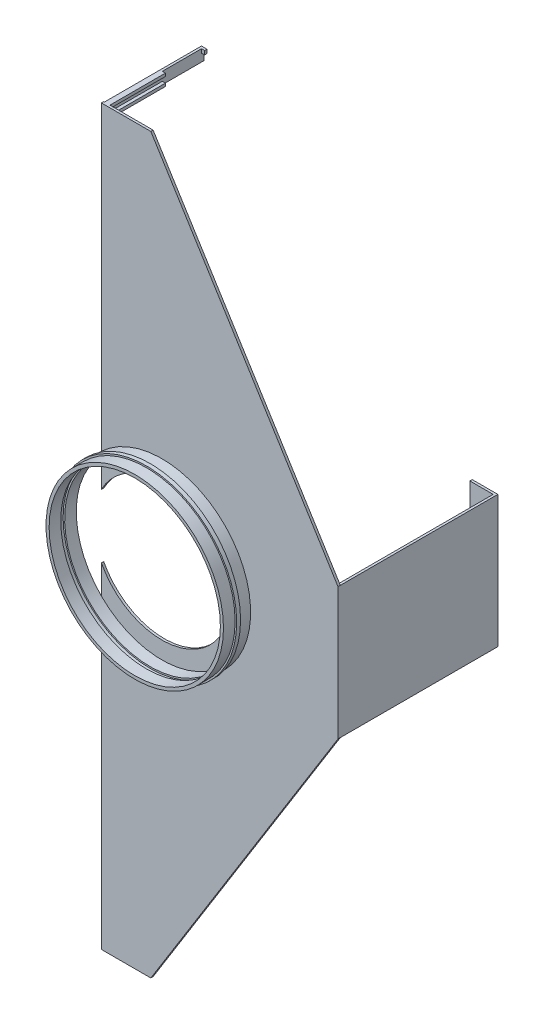
from build123d import *

# Parameters (mm, degrees)
SKETCH1_W       = 305
SKETCH1_H       = 945
EXTRUDE1_DEPTH  = 3
SKETCH2_R       = 114.37
SKETCH2_R_2     = 110.37
EXTRUDE2_DEPTH  = 15
SKETCH3_W       = 3
SKETCH3_H       = 15
EXTRUDE3_DEPTH  = 125
SKETCH4_W       = 3
SKETCH4_H       = 5
SKETCH4_H_2     = 6
SKETCH4_W_2     = 74.4375
SKETCH4_H_3     = 3.826546867
SKETCH4_H_4     = 3.798552334
SKETCH4_W_3     = 55.3875
SKETCH4_H_5     = 4.7625
SKETCH4_H_6     = 3.8875
EXTRUDE4_DEPTH  = 4
SKETCH5_W       = 3
SKETCH5_H       = 170
EXTRUDE5_DEPTH  = 203
SKETCH6_W       = 3
SKETCH6_H       = 170
EXTRUDE6_DEPTH  = 30
EXTRUDE7_DEPTH  = 1014.537863131
SKETCH13_R      = 88.098729295
EXTRUDE10_DEPTH = 1015.142987946
SKETCH22_R      = 116.4
SKETCH22_R_2    = 112.37
EXTRUDE17_DEPTH = 5
SKETCH23_R      = 114.37
SKETCH23_R_2    = 110.37
EXTRUDE18_DEPTH = 15


with BuildPart() as part:
    # Sketch1 → Extrude1 (new body)
    with BuildSketch(Plane.XY):
        with Locations((152.5, 472.5)):
            Rectangle(SKETCH1_W, SKETCH1_H)
    extrude(amount=EXTRUDE1_DEPTH)

    # Sketch2 → Extrude2 (add)
    with BuildSketch(Plane.XY.offset(3)):
        with Locations((78, 472.5)):
            Circle(SKETCH2_R)
        with Locations((78, 472.5)):
            Circle(SKETCH2_R_2, mode=Mode.SUBTRACT)
    extrude(amount=EXTRUDE2_DEPTH)

    # Sketch3 → Extrude3 (add)
    with BuildSketch(Plane(origin=(0, 0, 0), x_dir=(-1, 0, 0), z_dir=(0, 0, -1))):
        with Locations((-2.5, 937.5)):
            Rectangle(SKETCH3_W, SKETCH3_H)
        with Locations((-2.5, 7.5)):
            Rectangle(SKETCH3_W, SKETCH3_H)
    extrude(amount=EXTRUDE3_DEPTH)

    # Sketch4 → Extrude4 (add)
    with BuildSketch(Plane(origin=(4, 0, 0), x_dir=(0, 0, -1), z_dir=(1, 0, 0))):
        with Locations((123.5, 942.5)):
            Rectangle(SKETCH4_W, SKETCH4_H)
        with Locations((123.5, 3)):
            Rectangle(SKETCH4_W, SKETCH4_H_2)
        with Locations((34.21875, 943.086726567)):
            Rectangle(SKETCH4_W_2, SKETCH4_H_3)
        with Locations((34.21875, 931.899276167)):
            Rectangle(SKETCH4_W_2, SKETCH4_H_4)
        with Locations((24.69375, 2.38125)):
            Rectangle(SKETCH4_W_3, SKETCH4_H_5)
        with Locations((24.69375, 13.05625)):
            Rectangle(SKETCH4_W_3, SKETCH4_H_6)
    extrude(amount=EXTRUDE4_DEPTH)

    # Sketch5 → Extrude5 (add)
    with BuildSketch(Plane(origin=(0, 0, 0), x_dir=(-1, 0, 0), z_dir=(0, 0, -1))):
        with Locations((-303.5, 472.5)):
            Rectangle(SKETCH5_W, SKETCH5_H)
    extrude(amount=EXTRUDE5_DEPTH)

    # Sketch6 → Extrude6 (add)
    with BuildSketch(Plane.ZY.offset(-302)):
        with Locations((-201.5, 472.5)):
            Rectangle(SKETCH6_W, SKETCH6_H)
    extrude(amount=EXTRUDE6_DEPTH)

    # Sketch7 → Extrude7 (cut, through all)
    with BuildSketch(Plane(origin=(0, 0, 0), x_dir=(-1, 0, 0), z_dir=(0, 0, -1))):
        Polygon((-305, 557.5), (-63.714944106, 945), (-305, 945), align=None)
        Polygon((-305, 387.5), (-63.714944106, 0), (-305, 0), align=None)
    extrude(amount=-EXTRUDE7_DEPTH, mode=Mode.SUBTRACT)

    # Sketch13 → Extrude10 (cut, through all)
    with BuildSketch(Plane.XY.offset(3)):
        with Locations((78, 472.5)):
            Circle(SKETCH13_R)
    extrude(amount=-EXTRUDE10_DEPTH, mode=Mode.SUBTRACT)

    # Sketch22 → Extrude17 (add)
    with BuildSketch(Plane.XY.offset(18)):
        with Locations((78, 472.5)):
            Circle(SKETCH22_R)
        with Locations((78, 472.5)):
            Circle(SKETCH22_R_2, mode=Mode.SUBTRACT)
    extrude(amount=EXTRUDE17_DEPTH)

    # Sketch23 → Extrude18 (add)
    with BuildSketch(Plane.XY.offset(23)):
        with Locations((78, 472.5)):
            Circle(SKETCH23_R)
        with Locations((78, 472.5)):
            Circle(SKETCH23_R_2, mode=Mode.SUBTRACT)
    extrude(amount=EXTRUDE18_DEPTH)


solid = part.part
